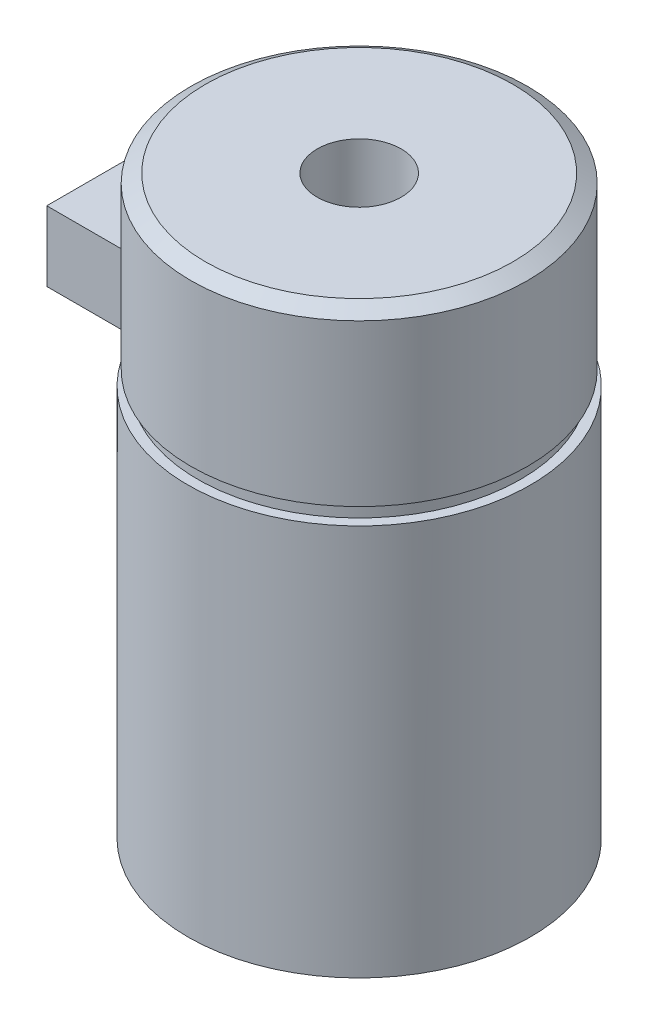
from build123d import *

# Parameters (mm, degrees)
SKETCH_3_R               = 12.25
EXTRUDE_1_DEPTH          = 28
EXTRUDE_4_DEPTH          = 4
EXTRUDE_4_DEPTH_BACK     = 4
SKETCH_6_W               = 9.418405285
SKETCH_6_H               = 5
SKETCH_10_R              = 6.5
EXTRUDE_5_DEPTH          = 2.5
CUT_EXTRUDE_1_DEPTH      = 49.953070378
CUT_EXTRUDE_1_DEPTH_BACK = 49.953070378
SKETCH_11_R              = 3
SKETCH1_R                = 1.5
CUT_EXTRUDE1_DEPTH       = 10


with BuildPart() as part:
    # 草图3 → 凸台-拉伸1 (new body)
    with BuildSketch(Plane(origin=(0, 0, 0), x_dir=(1, 0, 0), z_dir=(0, 1, 0))):
        Circle(SKETCH_3_R)
    extrude(amount=EXTRUDE_1_DEPTH)

    # 草图4 → 旋转1 (revolve)
    with BuildSketch(Plane.XY):
        Polygon((-11.550733632, 28), (0, 28), (0, 41.2), (-11, 41.2), (-12.039864428, 40.556952774), (-12.039864428, 29.048977507), (-11.550733632, 29.048977507), align=None)
    revolve(axis=Axis((0, 28, 0), (0, 1, 0)))

    # 草图6 → 凸台-拉伸4 (add, two sides: drawn at the far end of the back side and taken through both)
    with BuildSketch(Plane.XY.offset(-EXTRUDE_4_DEPTH_BACK)):
        with Locations((-13.638838111, 29.5)):
            Rectangle(SKETCH_6_W, SKETCH_6_H)
    extrude(amount=EXTRUDE_4_DEPTH + EXTRUDE_4_DEPTH_BACK)

    # 草图10 → 凸台-拉伸5 (add)
    with BuildSketch(Plane.XZ):
        Circle(SKETCH_10_R)
    extrude(amount=EXTRUDE_5_DEPTH)

    # 草图11 → 切除-拉伸1 (cut, two sides: drawn at the far end of the back side and taken through both)
    with BuildSketch(Plane.XZ.offset(2.5).offset(-CUT_EXTRUDE_1_DEPTH_BACK)):
        Circle(SKETCH_11_R)
    extrude(amount=CUT_EXTRUDE_1_DEPTH + CUT_EXTRUDE_1_DEPTH_BACK, mode=Mode.SUBTRACT)

    # Sketch1 → Cut-Extrude1 (cut)
    with BuildSketch(Plane.XZ):
        with Locations((9.5, 0)):
            Circle(SKETCH1_R)
        with Locations((-4.75, -8.227241336)):
            Circle(SKETCH1_R)
        with Locations((-4.75, 8.227241336)):
            Circle(SKETCH1_R)
    extrude(amount=-CUT_EXTRUDE1_DEPTH, mode=Mode.SUBTRACT)


solid = part.part
